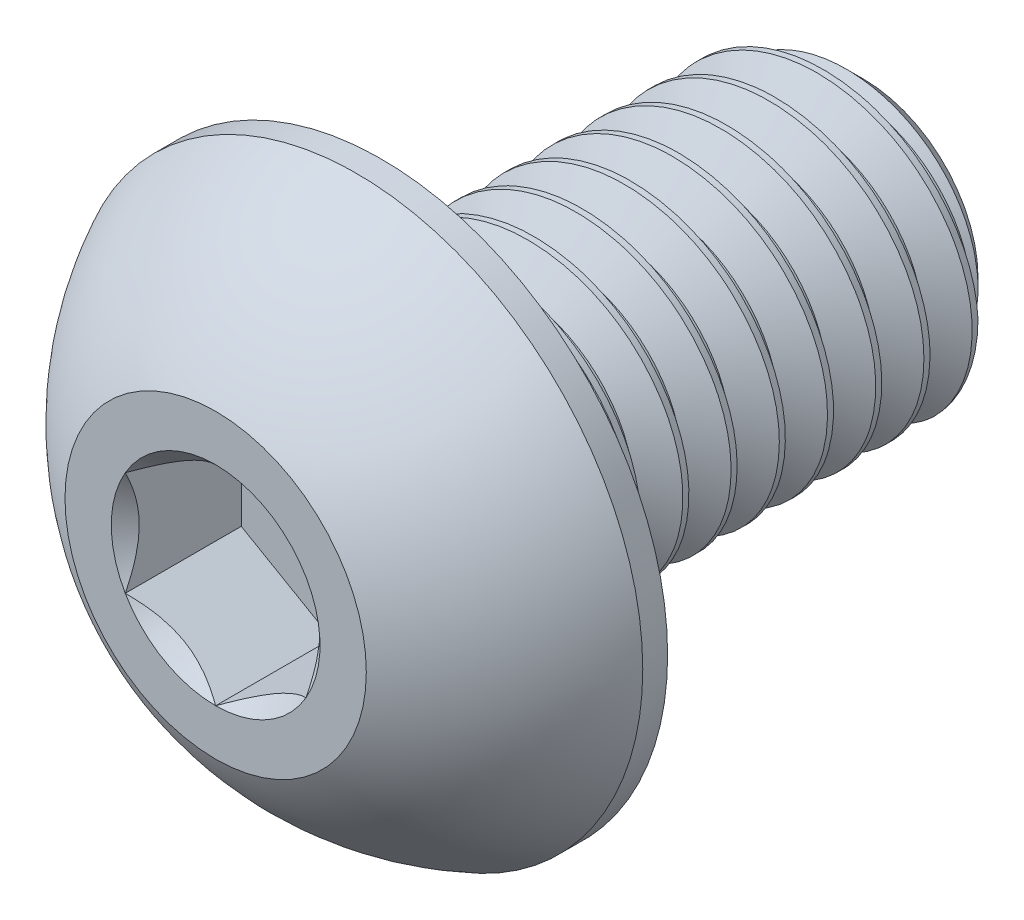
from build123d import *

# Parameters (mm, degrees)
CUT_EXTRUDE2_DEPTH = 1.925
CUT_SWEEP2_PITCH   = 0.8
CUT_SWEEP2_TO      = 8


with BuildPart() as part:
    # Sketch10 → Revolve3 (revolve)
    with BuildSketch(Plane(origin=(0, 0, 0), x_dir=(0, 0, -1), z_dir=(1, 0, 0)), mode=Mode.PRIVATE) as revolve3_sk:
        Polygon((10.15, 2.5), (10.75, 1.9), (10.75, 0), (2.75, 0), (2.75, 2.5), align=None)
    revolve(revolve3_sk.sketch.rotate(Axis((0, 0, 0), (0, 0, -1)), 90), axis=Axis((0, 0, 0), (0, 0, -1)))

    # Sketch7 → Revolve2 (revolve)
    with BuildSketch(Plane(origin=(0, 0, 0), x_dir=(0, 0, -1), z_dir=(1, 0, 0)), mode=Mode.PRIVATE) as revolve2_sk:
        with BuildLine():
            Line((2.3375, 4.75), (2.75, 4.75))
            Line((2.75, 4.75), (2.75, 0))
            Line((2.75, 0), (0, 0))
            Line((0, 0), (0, 2.5))
            ThreePointArc((0, 2.5), (0.991875183, 3.808753282), (2.3375, 4.75))
        make_face()
    revolve(revolve2_sk.sketch.rotate(Axis((0, 0, 0), (0, 0, -1)), 180), axis=Axis((0, 0, 0), (0, 0, -1)))

    # Sketch5 → Cut-Extrude2 (cut)
    with BuildSketch(Plane.XY):
        Polygon((1.5, -0.866025404), (1.5, 0.866025404), (0, 1.732050808), (-1.5, 0.866025404), (-1.5, -0.866025404), (0, -1.732050808), align=None)
    extrude(amount=-CUT_EXTRUDE2_DEPTH, mode=Mode.SUBTRACT)

    # Cut-Extrude3 cone 1 section (through the dimple's axis) → Cut-Extrude3 (revolve, cut)
    with BuildSketch(Plane(origin=(0, 0, 0), x_dir=(0, -1, 0), z_dir=(1, 0, 0))):
        Polygon((0, 0), (1.732050808, 0), (0, 1.732050808), align=None)
    revolve(axis=Axis((0, 0, 0), (0, 0, -1)), mode=Mode.SUBTRACT)


with BuildPart() as body_2:
    # Split1: read off the stored shape, not the designer's step
    # Split1: the piece on the far side of the plane
    add(part.part)
    split(bisect_by=Plane.XY.offset(-2.75), keep=Keep.BOTTOM)

    # Cut-Sweep2: arcs per turn and ends read off the stored shape
    # Cut-Sweep2: the profile of Sketch12 screwed along a right-hand helix through 15 turns, 8 arcs to a turn; built about Z, then put on its axis
    cut_sweep2_z = Axis((0, 0, 0), (0, 0, 1))
    cut_sweep2_corners = [(1.980384758, 0, -0.3), (1.980384758, 0, -0.4), (2.54330127, 0, -0.725), (2.54330127, 0, 0.025)]
    with BuildLine(mode=Mode.PRIVATE) as cut_sweep2_profile:
        Line(cut_sweep2_corners[0], cut_sweep2_corners[1])
        Line(cut_sweep2_corners[1], cut_sweep2_corners[2])
        Line(cut_sweep2_corners[2], cut_sweep2_corners[3])
        Line(cut_sweep2_corners[3], cut_sweep2_corners[0])
    cut_sweep2_cap = Face(cut_sweep2_profile.wire())
    cut_sweep2_turn_angles = [0, 22.5, 45, 67.5, 90, 112.5, 135, 157.5, 180, 202.5, 225, 247.5, 270, 292.5, 315, 337.5, 360]
    cut_sweep2_turn_weights = [1, 0.9238795325112867, 1, 0.9238795325112867, 1, 0.9238795325112867, 1, 0.9238795325112867, 1, 0.9238795325112867, 1, 0.9238795325112867, 1, 0.9238795325112867, 1, 0.9238795325112867, 1]
    cut_sweep2_turn_rails = [Edge.make_bspline([Vector(p[0], p[1], 0).rotate(cut_sweep2_z, cut_sweep2_turn_angles[k]) / cut_sweep2_turn_weights[k] + Vector(0, 0, p[2] + CUT_SWEEP2_PITCH * cut_sweep2_turn_angles[k] / 360) for k in range(17)], [0, 0, 0, 1, 1, 2, 2, 3, 3, 4, 4, 5, 5, 6, 6, 7, 7, 8, 8, 8], 2, cut_sweep2_turn_weights) for p in cut_sweep2_corners]
    cut_sweep2_turn_sides = [Face.make_surface_from_curves(cut_sweep2_turn_rails[p[0]], cut_sweep2_turn_rails[p[1]]) for p in [(0, 1), (1, 2), (2, 3), (3, 0)]]
    cut_sweep2 = Plane(origin=(0, 0, -10.75), x_dir=(0, 1, 0), z_dir=(0, 0, 1)) * split(Solid(Shell([*[p.moved(Location((0, 0, CUT_SWEEP2_PITCH * i))) for i in range(15) for p in cut_sweep2_turn_sides], cut_sweep2_cap, cut_sweep2_cap.rotate(cut_sweep2_z, 5400).moved(Location((0, 0, CUT_SWEEP2_PITCH * 5400 / 360)))])), bisect_by=Plane.XY.offset(CUT_SWEEP2_TO), keep=Keep.BOTTOM, mode=Mode.PRIVATE)
    add(cut_sweep2, mode=Mode.SUBTRACT)


with BuildPart() as part_1:
    add(part.part)

    # Split1
    split(bisect_by=Plane.XY.offset(-2.75), keep=Keep.TOP)

    add(body_2.part)  # Boss-Extrude1 merges body 2
    # Boss-Extrude1 cone 1 section (through the dimple's axis) → Boss-Extrude1 (revolve)
    with BuildSketch(Plane(origin=(0, 0, -2.75), x_dir=(0, -1, 0), z_dir=(1, 0, 0))):
        Polygon((0, 0), (2.5, 0), (0, 2.5), align=None)
    revolve(axis=Axis((0, 0, -2.75), (0, 0, -1)))


solid = part_1.part
